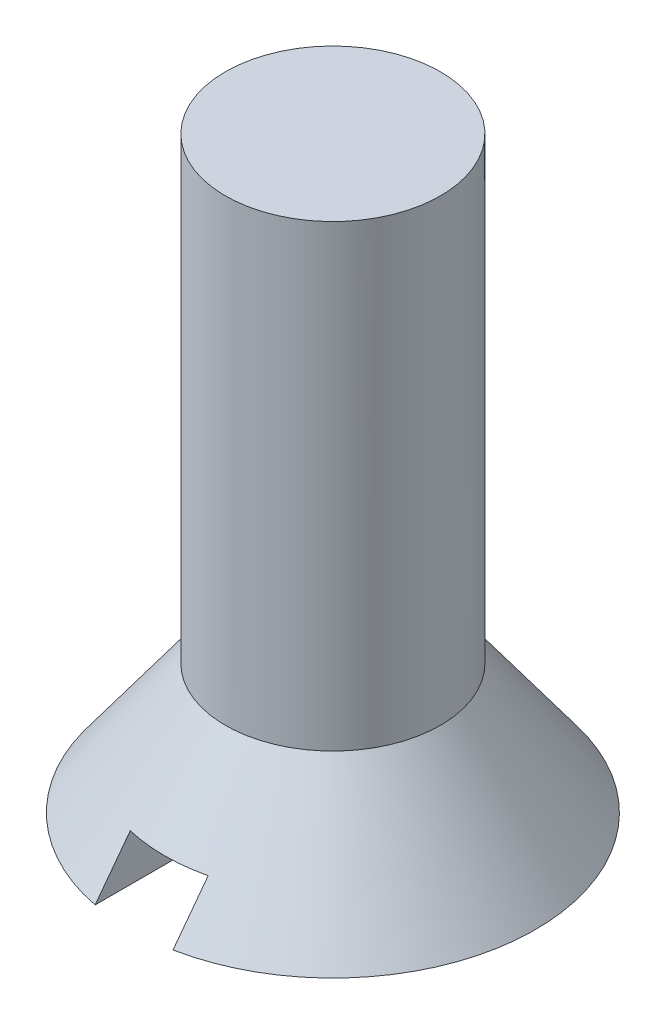
from build123d import *

# Parameters (mm, degrees)
SKETCH3_R               = 1.7526
BOSS_EXTRUDE1_DEPTH     = 7.47395
CUT_EXTRUDE1_DEPTH      = 4.1148
CUT_EXTRUDE1_DEPTH_BACK = 4.572


with BuildPart() as part:
    # Sketch2 → Revolve2 (revolve)
    with BuildSketch(Plane.XY):
        Polygon((3.302, 0), (0, 0), (0, 2.1082), (1.7526, 2.1082), align=None)
    revolve(axis=Axis((0, 2.1082, 0), (0, -1, 0)))

    # Sketch3 → Boss-Extrude1 (add)
    with BuildSketch(Plane(origin=(0, 2.1082, 0), x_dir=(-1, 0, 0), z_dir=(0, 1, 0))):
        Circle(SKETCH3_R)
    extrude(amount=BOSS_EXTRUDE1_DEPTH)

    # Sketch4 → Cut-Extrude1 (cut, two sides: drawn at the far end of the back side and taken through both)
    with BuildSketch(Plane.XY.offset(-CUT_EXTRUDE1_DEPTH_BACK)):
        Polygon((0, 0), (0.635, 0), (0.635, 0.762), (0.123756422, 0.762), (-0.635, 0.762), (-0.635, 0), align=None)
    extrude(amount=CUT_EXTRUDE1_DEPTH + CUT_EXTRUDE1_DEPTH_BACK, mode=Mode.SUBTRACT)


solid = part.part
